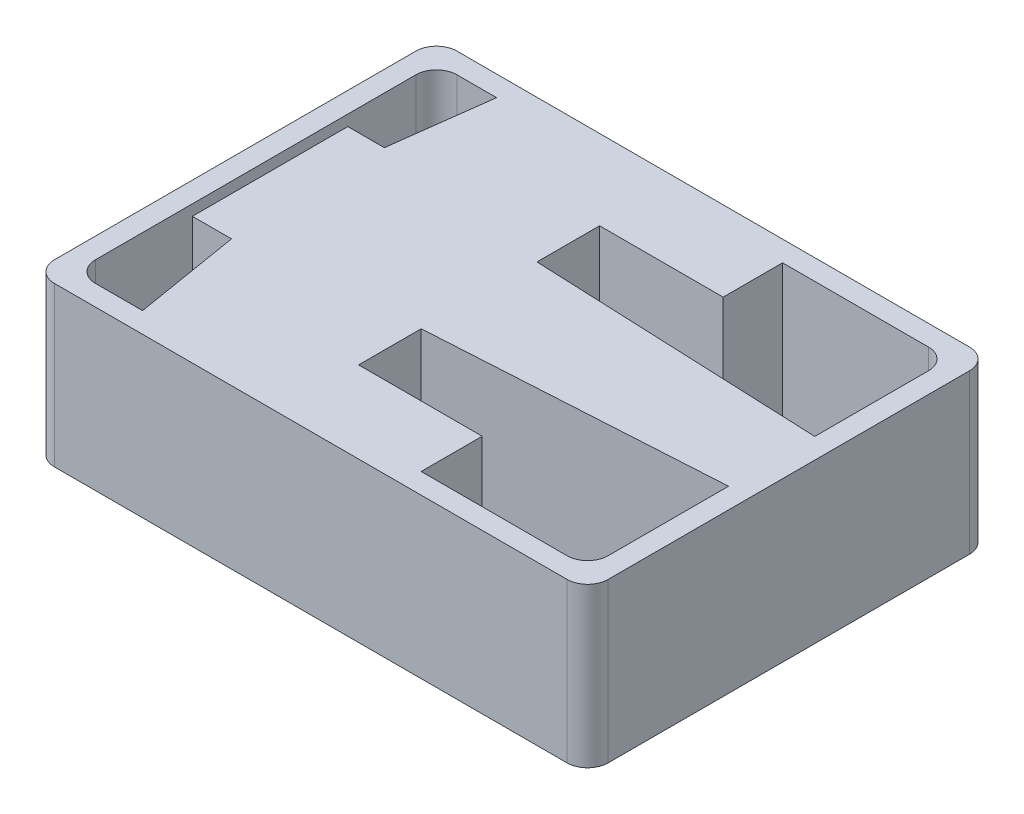
from build123d import *

# Parameters (mm, degrees)
SKETCH1_W              = 54
SKETCH1_H              = 39.25
BOSS_EXTRUDE1_DEPTH    = 46.5
FILLET1_R              = 2
FILLET2_R              = 2
Z_95_START             = -0.023652431
Z_95_BLANK_DEPTH       = 10
Z_95_START_2           = -5.023652431
Z_95_BLANK_2_OUTLINE_R = 2.5
Z_95_BLANK_2_DEPTH     = 5
BODY_MOVE_COPY3_ANGLE  = 180
BODY_MOVE_COPY4_ANGLE  = 89.5
SKETCH4_W              = 54
SKETCH4_H              = 39.25
CUT_EXTRUDE1_DEPTH     = 31
CUT_EXTRUDE2_DEPTH     = 31
BOSS_EXTRUDE2_DEPTH    = 2
FILLET3_R              = 2
FILLET4_R              = 2
FILLET5_R              = 2
FILLET6_R              = 2


with BuildPart() as part:
    # Sketch1 → Boss-Extrude1 (new body)
    with BuildSketch(Plane(origin=(0, 0, 0), x_dir=(1, 0, 0), z_dir=(0, 1, 0))):
        with Locations((27, 19.625)):
            Rectangle(SKETCH1_W, SKETCH1_H)
    extrude(amount=BOSS_EXTRUDE1_DEPTH)

    # Fillet1
    fillet1_edges = [part.edges().sort_by_distance(p)[0] for p in [
        (0, 23.25, 0),
    ]]
    fillet(fillet1_edges, radius=FILLET1_R)

    # Fillet2
    fillet2_edges = [part.edges().sort_by_distance(p)[0] for p in [
        (0, 23.25, -39.25),
        (54, 23.25, -39.25),
        (54, 23.25, 0),
    ]]
    fillet(fillet2_edges, radius=FILLET2_R)


with BuildPart() as body_2:
    # Z-95 Blank: read off the stored shape, not the designer's step
    # Z-95 Blank outline → Z-95 Blank (new body)
    with BuildSketch(Plane(origin=(0, 0, 0), x_dir=(1, 0, 0), z_dir=(0, 1, 0)).offset(Z_95_START)):
        Polygon((-39.475833264, 51.689675598), (-39.475833264, 48.062948495), (-51.475833264, 46.678320586), (-51.475833264, 23.139646129), (-47.225833264, 23.139646129), (-47.225833264, 35.139646129), (-37.225833264, 35.139646129), (-35.725833264, 5.689675598), (-31.225833264, 5.689675598), (-29.725833264, 35.139646129), (-19.725833264, 35.139646129), (-19.725833264, 23.139646129), (-15.475833264, 23.139646129), (-15.475833264, 46.678320586), (-27.475833264, 48.062948495), (-27.475833264, 51.689675598), align=None)
    extrude(amount=Z_95_BLANK_DEPTH)

    # Z-95 Blank 2 outline → Z-95 Blank 2 (add)
    with BuildSketch(Plane(origin=(0, 0, 0), x_dir=(1, 0, 0), z_dir=(0, 1, 0)).offset(Z_95_START_2)):
        with Locations((-33.475833264, 34.343753809)):
            Circle(Z_95_BLANK_2_OUTLINE_R)
    extrude(amount=Z_95_BLANK_2_DEPTH)


with BuildPart() as body_2_1:
    # Body-Move/Copy3: moved
    add(body_2.part.rotate(Axis((0, 2.476347569, -28.689675598), (1, 0, 0)), BODY_MOVE_COPY3_ANGLE))


with BuildPart() as body_2_2:
    # Body-Move/Copy4: moved
    add(body_2_1.part.rotate(Axis((-33.475833264, 0, -28.689675598), (0, -1, 0)), BODY_MOVE_COPY4_ANGLE))


with BuildPart() as body_2_3:
    # Body-Move/Copy5: moved
    add(body_2_2.part.moved(Location((61.536777905, 5.06338101, 8.948981511))))


with BuildPart() as body_2_4:
    # Body-Move/Copy6: moved
    add(body_2_3.part.moved(Location((0, -0.229742035, 0))))


with BuildPart() as part_1:
    add(part.part)

    # Intersect1: read off the stored shape, not the designer's step
    # Intersect1: cut body 2
    add(body_2_4.part, mode=Mode.SUBTRACT)

    # Sketch4 → Cut-Extrude1 (cut)
    with BuildSketch(Plane(origin=(0, 46.5, 0), x_dir=(1, 0, 0), z_dir=(0, 1, 0))):
        with Locations((27, 19.625)):
            Rectangle(SKETCH4_W, SKETCH4_H)
    extrude(amount=-CUT_EXTRUDE1_DEPTH, mode=Mode.SUBTRACT)

    # Sketch5 → Cut-Extrude2 (cut)
    with BuildSketch(Plane(origin=(0, 0, 0), x_dir=(-1, 0, 0), z_dir=(0, -1, 0))):
        Polygon((-23.713680343, 7.952308665), (-23.713680343, 14.054528407), (-52, 15.742860627), (-52, 2), (-35.766082295, 2), (-35.766082295, 7.952308665), align=None)
        Polygon((-23.713680343, 25.345964802), (-23.713680343, 31.453203507), (-35.766082295, 31.453203507), (-35.766082295, 37.25), (-52, 37.25), (-52, 24.152615413), align=None)
        Polygon((-6.871546498, 12.395456139), (-8.594812047, 2), (-2, 2), (-2, 37.25), (-7.869100925, 37.25), (-6.622123507, 27.553904956), (-3.057950712, 27.553904956), (-3.057950712, 12.395456139), align=None)
    extrude(amount=-CUT_EXTRUDE2_DEPTH, mode=Mode.SUBTRACT)

    # Sketch6 → Boss-Extrude2 (add)
    with BuildSketch(Plane.XZ):
        Polygon((52, -24.152615413), (23.713680343, -25.345964802), (23.713680343, -31.453203507), (35.766082295, -31.453203507), (35.766082295, -37.25), (52, -37.25), align=None)
        Polygon((52, -15.742860627), (23.713680343, -14.054528407), (23.713680343, -7.952308665), (35.766082295, -7.952308665), (35.766082295, -2), (52, -2), align=None)
        Polygon((8.594812047, -2), (6.871546498, -12.395456139), (3.057950712, -12.395456139), (3.057950712, -27.553904956), (6.622123507, -27.553904956), (7.869100925, -37.25), (2, -37.25), (2, -2), align=None)
    extrude(amount=-BOSS_EXTRUDE2_DEPTH)

    # Fillet3
    fillet3_edges = [part_1.edges().sort_by_distance(p)[0] for p in [
        (52, 8.75, -2),
    ]]
    fillet(fillet3_edges, radius=FILLET3_R)

    # Fillet4
    fillet4_edges = [part_1.edges().sort_by_distance(p)[0] for p in [
        (2, 8.75, -2),
    ]]
    fillet(fillet4_edges, radius=FILLET4_R)

    # Fillet5
    fillet5_edges = [part_1.edges().sort_by_distance(p)[0] for p in [
        (52, 8.75, -37.25),
    ]]
    fillet(fillet5_edges, radius=FILLET5_R)

    # Fillet6
    fillet6_edges = [part_1.edges().sort_by_distance(p)[0] for p in [
        (2, 8.75, -37.25),
    ]]
    fillet(fillet6_edges, radius=FILLET6_R)


solid = part_1.part
